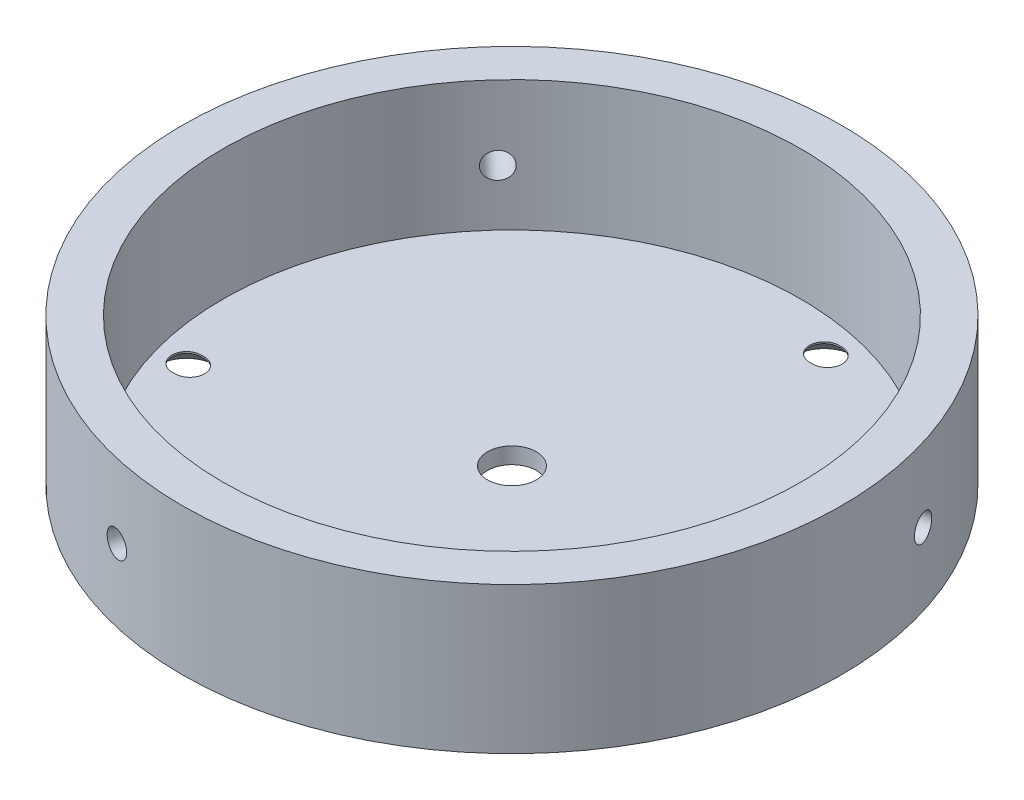
from build123d import *

# Parameters (mm, degrees)
SKETCH1_R                                     = 20.25
BOSS_EXTRUDE1_DEPTH                           = 9
SKETCH2_R                                     = 17.75
CUT_EXTRUDE1_DEPTH                            = 8
CSK_START                                     = -1
CSK_SLOT_FOR_M1_6_COUNTERSUNK_FLAT_HEAD_DEPTH = 3
CIRPATTERN1_START                             = -1
CIRPATTERN1_DEPTH                             = 3
SKETCH5_R                                     = 1.5
CUT_EXTRUDE2_DEPTH                            = 8
CIRPATTERN2_COUNT                             = 3


with BuildPart() as part:
    # Sketch1 → Boss-Extrude1 (new body)
    with BuildSketch(Plane(origin=(0, 0, 0), x_dir=(1, 0, 0), z_dir=(0, 1, 0))):
        with Locations(Location((0, 0, 0), (0, 0, 270))):
            Circle(SKETCH1_R)
    extrude(amount=BOSS_EXTRUDE1_DEPTH)

    # Sketch2 → Cut-Extrude1 (cut)
    with BuildSketch(Plane(origin=(0, 9, 0), x_dir=(1, 0, 0), z_dir=(0, 1, 0))):
        with Locations(Location((0, 0, 0), (0, 0, 270))):
            Circle(SKETCH2_R)
    extrude(amount=-CUT_EXTRUDE1_DEPTH, mode=Mode.SUBTRACT)

    # CSK SLOT for M1.6 Countersunk Flat Head: read off the stored shape, not the designer's step
    # CSK SLOT for M1.6 Countersunk Flat H 2 → CSK SLOT for M1.6 Countersunk Flat Head (cut)
    with BuildSketch(Plane(origin=(0, 0, 0), x_dir=(1, 0, 0), z_dir=(0, 1, 0)).offset(CSK_START)):
        with BuildLine():
            ThreePointArc((11.709715894, -11.90974554), (12.609715894, -11.00974554), (11.709715894, -10.10974554))
            Line((11.709715894, -10.10974554), (11.509715894, -10.10974554))
            ThreePointArc((11.509715894, -10.10974554), (10.609715894, -11.00974554), (11.509715894, -11.90974554))
            Line((11.509715894, -11.90974554), (11.709715894, -11.90974554))
        make_face()
    extrude(amount=CSK_SLOT_FOR_M1_6_COUNTERSUNK_FLAT_HEAD_DEPTH, mode=Mode.SUBTRACT)

    # CSK SLOT for M1.6 Countersunk Flat H 3: loft between two sections, ruled curve by curve
    csk_slot_for_m1_6_countersunk_flat_h_3_from = [
        Edge.make_three_point_arc((11.709715894, 0.9, 10.10974554), (12.346111997, 0.9, 10.373349437), (12.609715894, 0.9, 11.00974554)),
        Edge.make_three_point_arc((12.609715894, 0.9, 11.00974554), (12.346111997, 0.9, 11.646141643), (11.709715894, 0.9, 11.90974554)),
        Edge.make_three_point_arc((11.509715894, 0.9, 11.90974554), (10.873319791, 0.9, 11.646141643), (10.609715894, 0.9, 11.00974554)),
        Edge.make_three_point_arc((10.609715894, 0.9, 11.00974554), (10.873319791, 0.9, 10.373349437), (11.509715894, 0.9, 10.10974554)),
        Edge.make_line((11.709715894, 0.9, 11.90974554), (11.509715894, 0.9, 11.90974554)),
        Edge.make_line((11.709715894, 0.9, 10.10974554), (11.509715894, 0.9, 10.10974554)),
    ]
    csk_slot_for_m1_6_countersunk_flat_h_3_to = [
        Edge.make_three_point_arc((11.709715894, 0, 9.20974554), (12.9825081, 0, 9.736953334), (13.509715894, 0, 11.00974554)),
        Edge.make_three_point_arc((13.509715894, 0, 11.00974554), (12.9825081, 0, 12.282537747), (11.709715894, 0, 12.80974554)),
        Edge.make_three_point_arc((11.509715894, 0, 12.80974554), (10.236923688, 0, 12.282537747), (9.709715894, 0, 11.00974554)),
        Edge.make_three_point_arc((9.709715894, 0, 11.00974554), (10.236923688, 0, 9.736953334), (11.509715894, 0, 9.20974554)),
        Edge.make_line((11.709715894, 0, 12.80974554), (11.509715894, 0, 12.80974554)),
        Edge.make_line((11.709715894, 0, 9.20974554), (11.509715894, 0, 9.20974554)),
    ]
    csk_slot_for_m1_6_countersunk_flat_h_3 = Solid(Shell([*[Face.make_surface_from_curves(csk_slot_for_m1_6_countersunk_flat_h_3_from[k], csk_slot_for_m1_6_countersunk_flat_h_3_to[k]) for k in range(6)], Face(Wire(csk_slot_for_m1_6_countersunk_flat_h_3_from)), Face(Wire(csk_slot_for_m1_6_countersunk_flat_h_3_to))]))
    add(csk_slot_for_m1_6_countersunk_flat_h_3, mode=Mode.SUBTRACT)

    # CirPattern1: read off the stored shape, not the designer's step
    # CirPattern1 outline → CirPattern1 (cut)
    with BuildSketch(Plane(origin=(0, 0, 0), x_dir=(1, 0, 0), z_dir=(0, 1, 0)).offset(CIRPATTERN1_START)):
        with BuildLine():
            ThreePointArc((-15.239577274, -5.449436125), (-14.339577274, -4.549436125), (-15.239577274, -3.649436125))
            Line((-15.239577274, -3.649436125), (-15.439577274, -3.649436125))
            ThreePointArc((-15.439577274, -3.649436125), (-16.339577274, -4.549436125), (-15.439577274, -5.449436125))
            Line((-15.439577274, -5.449436125), (-15.239577274, -5.449436125))
        make_face()
        with BuildLine():
            ThreePointArc((3.82986138, 14.659181665), (4.72986138, 15.559181665), (3.82986138, 16.459181665))
            Line((3.82986138, 16.459181665), (3.62986138, 16.459181665))
            ThreePointArc((3.62986138, 16.459181665), (2.72986138, 15.559181665), (3.62986138, 14.659181665))
            Line((3.62986138, 14.659181665), (3.82986138, 14.659181665))
        make_face()
    extrude(amount=CIRPATTERN1_DEPTH, mode=Mode.SUBTRACT)

    # CirPattern1 2: loft between two sections, ruled curve by curve
    cirpattern1_2_from = [
        Edge.make_three_point_arc((-15.239577274, 0.9, 3.649436125), (-14.603181171, 0.9, 3.913040022), (-14.339577274, 0.9, 4.549436125)),
        Edge.make_three_point_arc((-14.339577274, 0.9, 4.549436125), (-14.603181171, 0.9, 5.185832228), (-15.239577274, 0.9, 5.449436125)),
        Edge.make_three_point_arc((-15.439577274, 0.9, 5.449436125), (-16.075973377, 0.9, 5.185832228), (-16.339577274, 0.9, 4.549436125)),
        Edge.make_three_point_arc((-16.339577274, 0.9, 4.549436125), (-16.075973377, 0.9, 3.913040022), (-15.439577274, 0.9, 3.649436125)),
        Edge.make_line((-15.239577274, 0.9, 5.449436125), (-15.439577274, 0.9, 5.449436125)),
        Edge.make_line((-15.239577274, 0.9, 3.649436125), (-15.439577274, 0.9, 3.649436125)),
    ]
    cirpattern1_2_to = [
        Edge.make_three_point_arc((-15.239577274, 0, 2.749436125), (-13.966785068, 0, 3.276643918), (-13.439577274, 0, 4.549436125)),
        Edge.make_three_point_arc((-13.439577274, 0, 4.549436125), (-13.966785068, 0, 5.822228331), (-15.239577274, 0, 6.349436125)),
        Edge.make_three_point_arc((-15.439577274, 0, 6.349436125), (-16.71236948, 0, 5.822228331), (-17.239577274, 0, 4.549436125)),
        Edge.make_three_point_arc((-17.239577274, 0, 4.549436125), (-16.71236948, 0, 3.276643918), (-15.439577274, 0, 2.749436125)),
        Edge.make_line((-15.239577274, 0, 6.349436125), (-15.439577274, 0, 6.349436125)),
        Edge.make_line((-15.239577274, 0, 2.749436125), (-15.439577274, 0, 2.749436125)),
    ]
    cirpattern1_2 = Solid(Shell([*[Face.make_surface_from_curves(cirpattern1_2_from[k], cirpattern1_2_to[k]) for k in range(6)], Face(Wire(cirpattern1_2_from)), Face(Wire(cirpattern1_2_to))]))
    add(cirpattern1_2, mode=Mode.SUBTRACT)

    # CirPattern1 3: loft between two sections, ruled curve by curve
    cirpattern1_3_from = [
        Edge.make_three_point_arc((3.82986138, 0.9, -16.459181665), (4.466257483, 0.9, -16.195577768), (4.72986138, 0.9, -15.559181665)),
        Edge.make_three_point_arc((4.72986138, 0.9, -15.559181665), (4.466257483, 0.9, -14.922785562), (3.82986138, 0.9, -14.659181665)),
        Edge.make_three_point_arc((3.62986138, 0.9, -14.659181665), (2.993465277, 0.9, -14.922785562), (2.72986138, 0.9, -15.559181665)),
        Edge.make_three_point_arc((2.72986138, 0.9, -15.559181665), (2.993465277, 0.9, -16.195577768), (3.62986138, 0.9, -16.459181665)),
        Edge.make_line((3.82986138, 0.9, -14.659181665), (3.62986138, 0.9, -14.659181665)),
        Edge.make_line((3.82986138, 0.9, -16.459181665), (3.62986138, 0.9, -16.459181665)),
    ]
    cirpattern1_3_to = [
        Edge.make_three_point_arc((3.82986138, 0, -17.359181665), (5.102653586, 0, -16.831973871), (5.62986138, 0, -15.559181665)),
        Edge.make_three_point_arc((5.62986138, 0, -15.559181665), (5.102653586, 0, -14.286389459), (3.82986138, 0, -13.759181665)),
        Edge.make_three_point_arc((3.62986138, 0, -13.759181665), (2.357069174, 0, -14.286389459), (1.82986138, 0, -15.559181665)),
        Edge.make_three_point_arc((1.82986138, 0, -15.559181665), (2.357069174, 0, -16.831973871), (3.62986138, 0, -17.359181665)),
        Edge.make_line((3.82986138, 0, -13.759181665), (3.62986138, 0, -13.759181665)),
        Edge.make_line((3.82986138, 0, -17.359181665), (3.62986138, 0, -17.359181665)),
    ]
    cirpattern1_3 = Solid(Shell([*[Face.make_surface_from_curves(cirpattern1_3_from[k], cirpattern1_3_to[k]) for k in range(6)], Face(Wire(cirpattern1_3_from)), Face(Wire(cirpattern1_3_to))]))
    add(cirpattern1_3, mode=Mode.SUBTRACT)

    # Sketch5 → Cut-Extrude2 (cut)
    with BuildSketch(Plane.XZ):
        with Locations(Location((0, 0, 0), (0, 0, 270))):
            Circle(SKETCH5_R)
    extrude(amount=-CUT_EXTRUDE2_DEPTH, mode=Mode.SUBTRACT)

    # Sketch6 → M2 Tapped Hole1 (revolve, cut)
    with BuildSketch(Plane(origin=(-4.560794248, 4.445790719, 19.729715047), x_dir=(0.974306915892993, 0, 0.22522440729877435), z_dir=(0, 1, 0))):
        Polygon((0, 0), (0, 4.980688495), (0.8, 4.5), (0.8, 0), align=None)
    m2_tapped_hole1 = revolve(axis=Axis((-5.990969234, 4.445790719, 25.916563963), (0.22522440729877433, 0, -0.9743069158929931)), mode=Mode.SUBTRACT)

    # CirPattern2: M2 Tapped Hole1 ×3 about axis
    cirpattern2_axis = Axis((0, 9, 0), (0, -1, 0))
    for i in range(1, CIRPATTERN2_COUNT):
        add(m2_tapped_hole1.rotate(cirpattern2_axis, i * 360 / CIRPATTERN2_COUNT), mode=Mode.SUBTRACT)


solid = part.part
